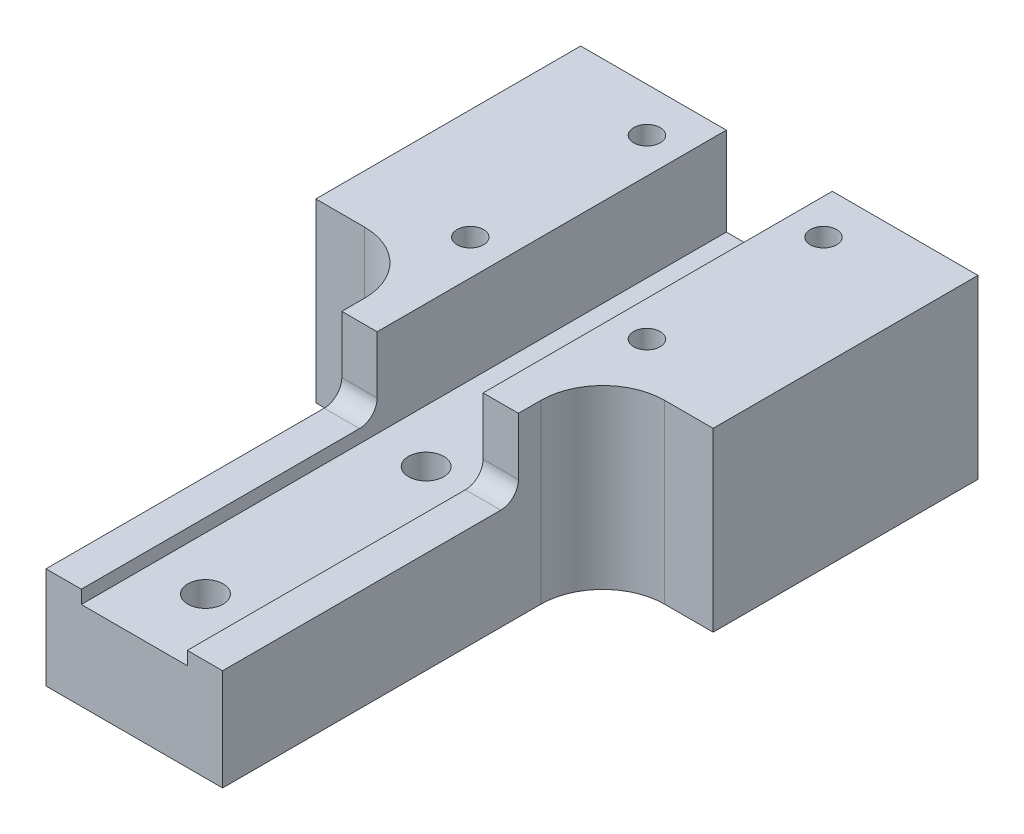
from build123d import *

# Parameters (mm, degrees)
SKETCH1_R           = 1.5
SKETCH1_R_2         = 2
BOSS_EXTRUDE2_DEPTH = 20
SKETCH5_W           = 12
SKETCH5_H           = 100
CUT_EXTRUDE1_DEPTH  = 10
FILLET1_R           = 7
SKETCH7_W           = 29.697028674
SKETCH7_H           = 34.988499238
CUT_EXTRUDE2_DEPTH  = 64.31883257
FILLET3_R           = 2


with BuildPart() as part:
    # Sketch1 → Boss-Extrude2 (new body)
    with BuildSketch(Plane(origin=(0, 0, 0), x_dir=(1, 0, 0), z_dir=(0, 1, 0))):
        Polygon((22.5, 15), (-22.5, 15), (-22.5, -15), (-10, -15), (-10, -58.058371989), (10, -58.058371989), (10, -15), (22.5, -15), align=None)
        with Locations((-10, -10)):
            Circle(SKETCH1_R, mode=Mode.SUBTRACT)
        with Locations((-10, 10)):
            Circle(SKETCH1_R, mode=Mode.SUBTRACT)
        with Locations((10, -10)):
            Circle(SKETCH1_R, mode=Mode.SUBTRACT)
        with Locations((10, 10)):
            Circle(SKETCH1_R, mode=Mode.SUBTRACT)
        with Locations((0, -25)):
            Circle(SKETCH1_R_2, mode=Mode.SUBTRACT)
        with Locations((0, -50)):
            Circle(SKETCH1_R_2, mode=Mode.SUBTRACT)
    extrude(amount=-BOSS_EXTRUDE2_DEPTH)

    # Sketch5 → Cut-Extrude1 (cut)
    with BuildSketch(Plane(origin=(0, 0, 0), x_dir=(1, 0, 0), z_dir=(0, 1, 0))):
        with Locations((0, -16.465194583)):
            Rectangle(SKETCH5_W, SKETCH5_H)
    extrude(amount=-CUT_EXTRUDE1_DEPTH, mode=Mode.SUBTRACT)

    # Fillet1
    fillet1_edges = [part.edges().sort_by_distance(p)[0] for p in [
        (-10, -10, 15),
        (10, -10, 15),
    ]]
    fillet(fillet1_edges, radius=FILLET1_R)

    # Sketch7 → Cut-Extrude2 (cut, through all)
    with BuildSketch(Plane(origin=(0, -8.5, 0), x_dir=(1, 0, 0), z_dir=(0, 1, 0))):
        with Locations((-0.809918964, -42.047133079)):
            Rectangle(SKETCH7_W, SKETCH7_H)
    extrude(amount=CUT_EXTRUDE2_DEPTH, mode=Mode.SUBTRACT)

    # Fillet3
    fillet3_edges = [part.edges().sort_by_distance(p)[0] for p in [
        (8, -8.5, 24.55288346),
        (-8, -8.5, 24.55288346),
    ]]
    fillet(fillet3_edges, radius=FILLET3_R)


solid = part.part
